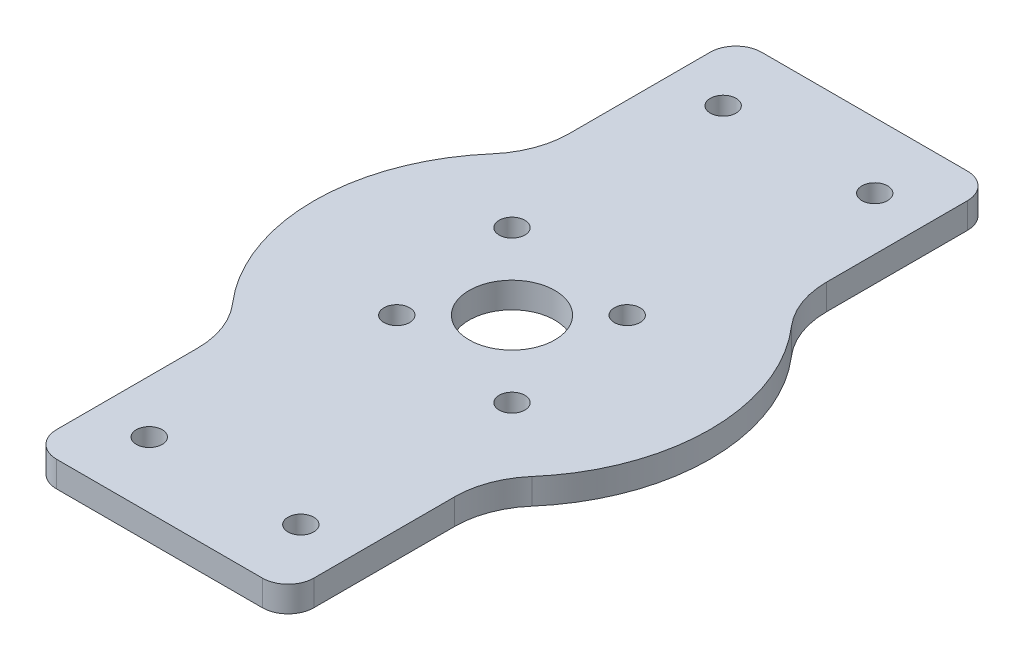
from build123d import *

# Parameters (mm, degrees)
SKETCH1_R           = 1.5
SKETCH1_R_2         = 5
BOSS_EXTRUDE1_DEPTH = 3


with BuildPart() as part:
    # Sketch1 → Boss-Extrude1 (new body)
    with BuildSketch(Plane(origin=(0, 0, 0), x_dir=(1, 0, 0), z_dir=(0, 1, 0))):
        with BuildLine():
            Line((-15, 21.693547428), (-15, 38.108016468))
            ThreePointArc((-15, 38.108016468), (-14.121320344, 40.229336812), (-12, 41.108016468))
            Line((-12, 41.108016468), (12, 41.108016468))
            ThreePointArc((12, 41.108016468), (14.121320344, 40.229336812), (15, 38.108016468))
            Line((15, 38.108016468), (15, 21.693547428))
            ThreePointArc((15, 21.693547428), (15.631737063, 18.195598093), (17.447129909, 15.139605607))
            ThreePointArc((17.447129909, 15.139605607), (23.1, 0), (17.447129909, -15.139605607))
            ThreePointArc((17.447129909, -15.139605607), (15.631737063, -18.195598093), (15, -21.693547428))
            Line((15, -21.693547428), (15, -38.108016468))
            ThreePointArc((15, -38.108016468), (14.121320344, -40.229336812), (12, -41.108016468))
            Line((12, -41.108016468), (-12, -41.108016468))
            ThreePointArc((-12, -41.108016468), (-14.121320344, -40.229336812), (-15, -38.108016468))
            Line((-15, -38.108016468), (-15, -21.693547428))
            ThreePointArc((-15, -21.693547428), (-15.631737063, -18.195598093), (-17.447129909, -15.139605607))
            ThreePointArc((-17.447129909, -15.139605607), (-23.1, 0), (-17.447129909, 15.139605607))
            ThreePointArc((-17.447129909, 15.139605607), (-15.631737063, 18.195598093), (-15, 21.693547428))
        make_face()
        with Locations((-8.838834765, 8.838834765)):
            Circle(SKETCH1_R, mode=Mode.SUBTRACT)
        with Locations((8.838834765, -8.838834765)):
            Circle(SKETCH1_R, mode=Mode.SUBTRACT)
        with Locations((6.717514421, 6.717514421)):
            Circle(SKETCH1_R, mode=Mode.SUBTRACT)
        with Locations((-6.717514421, -6.717514421)):
            Circle(SKETCH1_R, mode=Mode.SUBTRACT)
        Circle(SKETCH1_R_2, mode=Mode.SUBTRACT)
        with Locations((-8.838834765, 33.462792438)):
            Circle(SKETCH1_R, mode=Mode.SUBTRACT)
        with Locations((8.838834765, 33.462792438)):
            Circle(SKETCH1_R, mode=Mode.SUBTRACT)
        with Locations((8.838834765, -33.462792438)):
            Circle(SKETCH1_R, mode=Mode.SUBTRACT)
        with Locations((-8.838834765, -33.462792438)):
            Circle(SKETCH1_R, mode=Mode.SUBTRACT)
    extrude(amount=BOSS_EXTRUDE1_DEPTH)


solid = part.part
